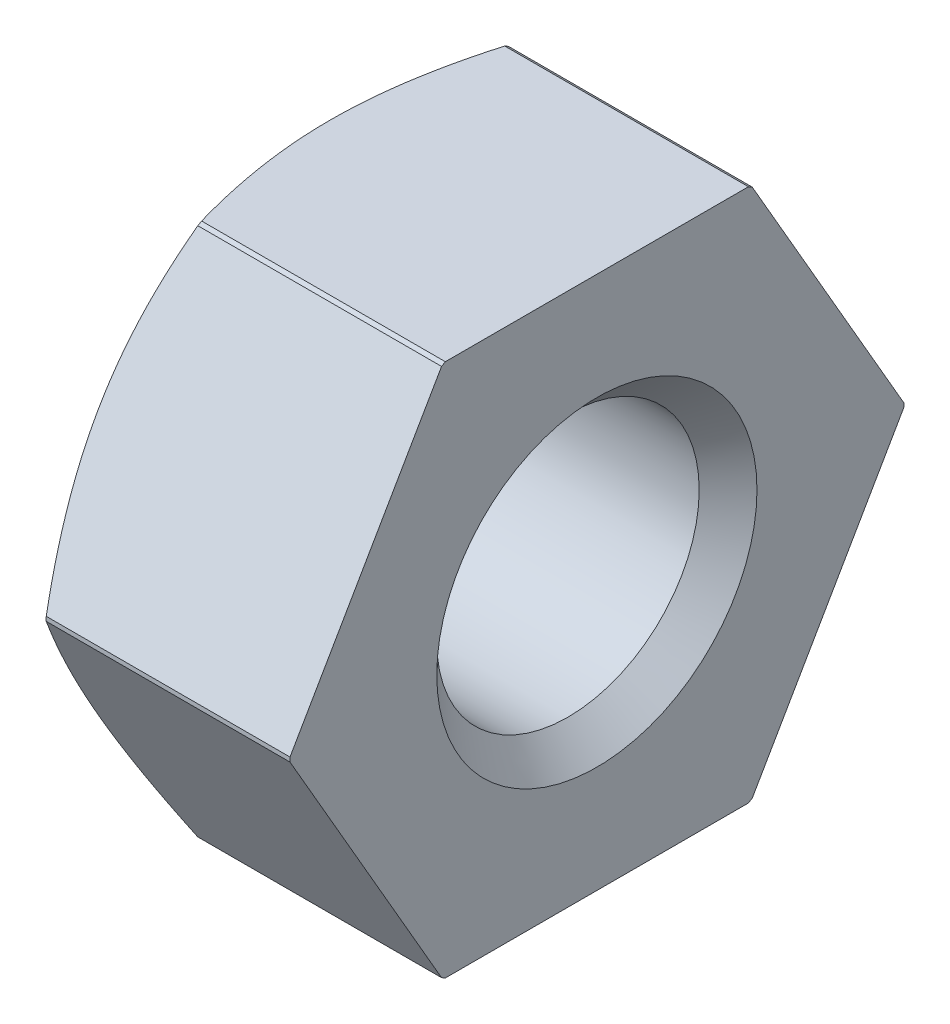
from build123d import *

# Parameters (mm, degrees)
CUT_EXTRUDE_1_DEPTH      = 2.5
CUT_EXTRUDE_1_DEPTH_BACK = 2.5
SKETCH_3_W               = 20
SKETCH_3_H               = 20


with BuildPart() as part:
    # 草图1 → 旋转1 (revolve)
    with BuildSketch(Plane.XY):
        Polygon((-2.5, 0), (-2.5, 5), (-2.066987298, 5.75), (2.5, 5.75), (2.5, 0), align=None)
    revolve(axis=Axis((2.5, 0, 0), (-1, 0, 0)))

    # 草图2 → 切除-旋转1 (revolve, cut)
    with BuildSketch(Plane.XY):
        Polygon((-2.5, 0), (-2.5, 3), (-1.9585, 2.4585), (1.9585, 2.4585), (2.5, 3), (2.5, 0), align=None)
    revolve(axis=Axis((2.5, 0, 0), (-1, 0, 0)), mode=Mode.SUBTRACT)

    # 草图3 → 切除-拉伸1 (cut, two sides: drawn at the far end of the back side and taken through both)
    with BuildSketch(Plane(origin=(0, 0, 0), x_dir=(0, 0, -1), z_dir=(1, 0, 0)).offset(-CUT_EXTRUDE_1_DEPTH_BACK)):
        Rectangle(SKETCH_3_W, SKETCH_3_H)
        Polygon((-5.773502692, 0), (-2.886751346, -5), (2.886751346, -5), (5.773502692, 0), (2.886751346, 5), (-2.886751346, 5), align=None, mode=Mode.SUBTRACT)
    extrude(amount=CUT_EXTRUDE_1_DEPTH + CUT_EXTRUDE_1_DEPTH_BACK, mode=Mode.SUBTRACT)


solid = part.part
